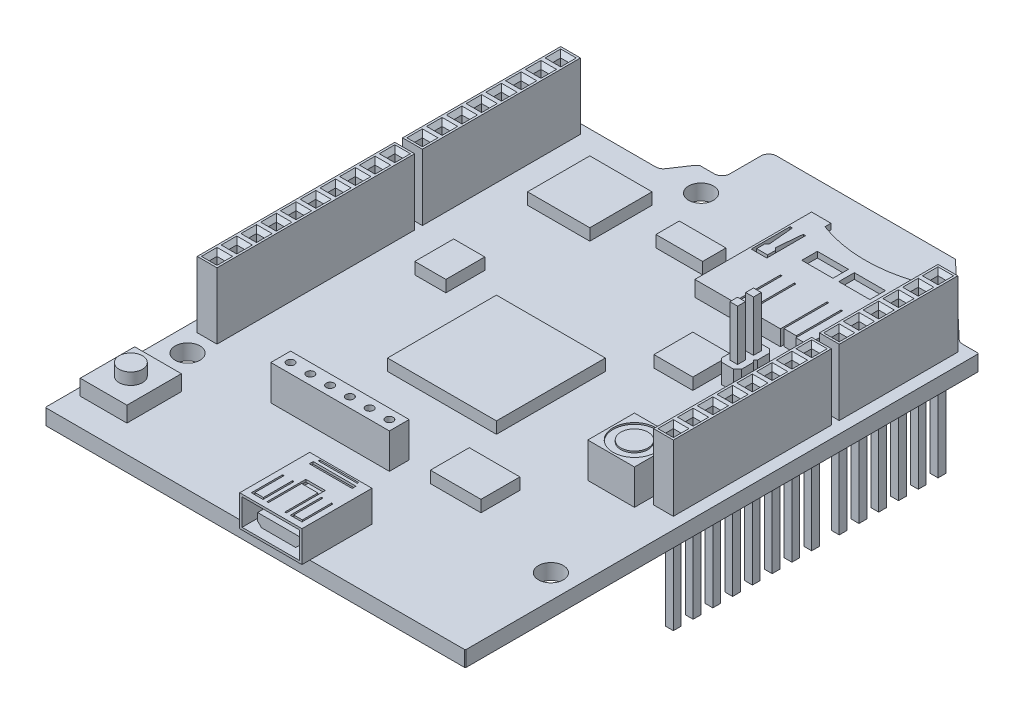
from build123d import *
from OCP.BRepFilletAPI import BRepFilletAPI_MakeChamfer

# Parameters (mm, degrees)
BOSS_EXTRU_1_DEPTH           = 2
ESQUISSE2_W                  = 2.54
ESQUISSE2_H                  = 20.32
ESQUISSE2_W_2                = 1
ESQUISSE2_H_2                = 1
ESQUISSE2_H_3                = 25.4
ESQUISSE2_H_4                = 15.24
BOSS_EXTRU_2_DEPTH           = 8.5
ESQUISSE3_R                  = 1.6
ENL_V_MAT_EXTRU_1_DEPTH      = 93.807596672
ESQUISSE4_W                  = 7.62
ESQUISSE4_H                  = 5.08
ESQUISSE4_W_2                = 1
ESQUISSE4_H_2                = 1
BOSS_EXTRU_3_DEPTH           = 11.5
ESQUISSE5_W                  = 15.24
ESQUISSE5_H                  = 2.54
ESQUISSE5_R                  = 0.5
BOSS_EXTRU_4_DEPTH           = 4.5
ESQUISSE6_W                  = 14
ESQUISSE6_H                  = 14
ESQUISSE6_W_2                = 8
ESQUISSE6_H_2                = 8
ESQUISSE6_W_3                = 6
ESQUISSE6_H_3                = 3
ESQUISSE6_W_4                = 4
ESQUISSE6_H_4                = 5
ESQUISSE6_W_5                = 5
ESQUISSE6_W_6                = 6.5
BOSS_EXTRU_5_DEPTH           = 1.5
ESQUISSE7_W                  = 6
ESQUISSE7_H                  = 7
BOSS_EXTRU_6_DEPTH           = 2
ESQUISSE8_R                  = 1.5
BOSS_EXTRU_7_DEPTH           = 3.5
ESQUISSE9_W                  = 6
ESQUISSE9_H                  = 6
BOSS_EXTRU_8_DEPTH           = 4.5
ESQUISSE10_R                 = 2.75
ESQUISSE10_R_2               = 1.75
ENL_V_MAT_EXTRU_2_DEPTH      = 0.2
ESQUISSE12_W                 = 1
ESQUISSE12_H                 = 1
BOSS_EXTRU_9_DEPTH           = 11.5
BOSS_EXTRU_10_DEPTH          = 2.5
ESQUISSE14_W                 = 1
ESQUISSE14_H                 = 1
BOSS_EXTRU_11_DEPTH          = 9
ESQUISSE15_W                 = 14.5
ESQUISSE15_H                 = 15
BOSS_EXTRU_12_DEPTH          = 2
ESQUISSE16_W                 = 4
ESQUISSE16_H                 = 2
ENL_V_MAT_EXTRU_3_DEPTH      = 94.398340456
ENL_V_MAT_EXTRU_4_DEPTH      = 11.25
ENL_V_MAT_EXTRU_4_DEPTH_BACK = 87.047951748
ESQUISSE17_W                 = 13
ESQUISSE17_H                 = 1.25
ESQUISSE18_W                 = 8
ESQUISSE18_H                 = 9
BOSS_EXTRU_14_DEPTH          = 4
ESQUISSE19_W                 = 5
ESQUISSE19_H                 = 0.2
ESQUISSE19_W_2               = 5.5
ESQUISSE19_H_2               = 0.5
ENL_V_MAT_EXTRU_5_DEPTH      = 0.5
ESQUISSE20_W                 = 7.4
ESQUISSE20_H                 = 3.4
ESQUISSE20_W_2               = 5.4
ESQUISSE20_H_2               = 1.45
ENL_V_MAT_EXTRU_6_DEPTH      = 7.7
ESQUISSE20_2_W               = 7.4
ESQUISSE20_2_H               = 3.4
ENL_V_MAT_EXTRU_7_DEPTH      = 94.130285085
CHANFREIN1_SIZE              = 0.1
CHANFREIN1_SIZE2             = 0.360555128
CHANFREIN2_SIZE              = 0.5
CHANFREIN3_SIZE              = 0.5
CONG_1_R                     = 1


with BuildPart() as part:
    # Esquisse1 → Boss.-Extru.1 (new body)
    with BuildSketch(Plane(origin=(0, 0, 0), x_dir=(1, 0, 0), z_dir=(0, 1, 0))):
        Polygon((0, 0), (54, 0), (54, 66), (51.5, 66), (42, 75), (18, 75), (18, 69), (15, 69), (13, 66), (0, 66), align=None)
    extrude(amount=BOSS_EXTRU_1_DEPTH)

    # Esquisse2 → Boss.-Extru.2 (add)
    # profile 1 of 4: a face of its own
    with BuildSketch(Plane(origin=(0, 2, 0), x_dir=(1, 0, 0), z_dir=(0, 1, 0))):
        with Locations((2.73, 54.64)):
            Rectangle(ESQUISSE2_W, ESQUISSE2_H)
        with Locations((2.73, 60.99)):
            Rectangle(ESQUISSE2_W_2, ESQUISSE2_H_2, mode=Mode.SUBTRACT)
        with Locations((2.73, 63.53)):
            Rectangle(ESQUISSE2_W_2, ESQUISSE2_H_2, mode=Mode.SUBTRACT)
        with Locations((2.73, 58.45)):
            Rectangle(ESQUISSE2_W_2, ESQUISSE2_H_2, mode=Mode.SUBTRACT)
        with Locations((2.73, 55.91)):
            Rectangle(ESQUISSE2_W_2, ESQUISSE2_H_2, mode=Mode.SUBTRACT)
        with Locations((2.73, 53.37)):
            Rectangle(ESQUISSE2_W_2, ESQUISSE2_H_2, mode=Mode.SUBTRACT)
        with Locations((2.73, 50.83)):
            Rectangle(ESQUISSE2_W_2, ESQUISSE2_H_2, mode=Mode.SUBTRACT)
        with Locations((2.73, 48.29)):
            Rectangle(ESQUISSE2_W_2, ESQUISSE2_H_2, mode=Mode.SUBTRACT)
        with Locations((2.73, 45.75)):
            Rectangle(ESQUISSE2_W_2, ESQUISSE2_H_2, mode=Mode.SUBTRACT)
    # profile 2 of 4: a face of its own
    with BuildSketch(Plane(origin=(0, 2, 0), x_dir=(1, 0, 0), z_dir=(0, 1, 0))):
        with Locations((2.73, 30.78)):
            Rectangle(ESQUISSE2_W, ESQUISSE2_H_3)
        with Locations((2.73, 21.89)):
            Rectangle(ESQUISSE2_W_2, ESQUISSE2_H_2, mode=Mode.SUBTRACT)
        with Locations((2.73, 19.35)):
            Rectangle(ESQUISSE2_W_2, ESQUISSE2_H_2, mode=Mode.SUBTRACT)
        with Locations((2.73, 24.43)):
            Rectangle(ESQUISSE2_W_2, ESQUISSE2_H_2, mode=Mode.SUBTRACT)
        with Locations((2.73, 26.97)):
            Rectangle(ESQUISSE2_W_2, ESQUISSE2_H_2, mode=Mode.SUBTRACT)
        with Locations((2.73, 29.51)):
            Rectangle(ESQUISSE2_W_2, ESQUISSE2_H_2, mode=Mode.SUBTRACT)
        with Locations((2.73, 32.05)):
            Rectangle(ESQUISSE2_W_2, ESQUISSE2_H_2, mode=Mode.SUBTRACT)
        with Locations((2.73, 34.59)):
            Rectangle(ESQUISSE2_W_2, ESQUISSE2_H_2, mode=Mode.SUBTRACT)
        with Locations((2.73, 37.13)):
            Rectangle(ESQUISSE2_W_2, ESQUISSE2_H_2, mode=Mode.SUBTRACT)
        with Locations((2.73, 39.67)):
            Rectangle(ESQUISSE2_W_2, ESQUISSE2_H_2, mode=Mode.SUBTRACT)
        with Locations((2.73, 42.21)):
            Rectangle(ESQUISSE2_W_2, ESQUISSE2_H_2, mode=Mode.SUBTRACT)
    # profile 3 of 4: a face of its own
    with BuildSketch(Plane(origin=(0, 2, 0), x_dir=(1, 0, 0), z_dir=(0, 1, 0))):
        with Locations((51.23, 57.18)):
            Rectangle(ESQUISSE2_W, ESQUISSE2_H_4)
        with Locations((51.23, 60.99)):
            Rectangle(ESQUISSE2_W_2, ESQUISSE2_H_2, mode=Mode.SUBTRACT)
        with Locations((51.23, 63.53)):
            Rectangle(ESQUISSE2_W_2, ESQUISSE2_H_2, mode=Mode.SUBTRACT)
        with Locations((51.23, 58.45)):
            Rectangle(ESQUISSE2_W_2, ESQUISSE2_H_2, mode=Mode.SUBTRACT)
        with Locations((51.23, 55.91)):
            Rectangle(ESQUISSE2_W_2, ESQUISSE2_H_2, mode=Mode.SUBTRACT)
        with Locations((51.23, 53.37)):
            Rectangle(ESQUISSE2_W_2, ESQUISSE2_H_2, mode=Mode.SUBTRACT)
        with Locations((51.23, 50.83)):
            Rectangle(ESQUISSE2_W_2, ESQUISSE2_H_2, mode=Mode.SUBTRACT)
    # profile 4 of 4: a face of its own
    with BuildSketch(Plane(origin=(0, 2, 0), x_dir=(1, 0, 0), z_dir=(0, 1, 0))):
        with Locations((51.23, 38.4)):
            Rectangle(ESQUISSE2_W, ESQUISSE2_H)
        with Locations((51.23, 47.29)):
            Rectangle(ESQUISSE2_W_2, ESQUISSE2_H_2, mode=Mode.SUBTRACT)
        with Locations((51.23, 44.75)):
            Rectangle(ESQUISSE2_W_2, ESQUISSE2_H_2, mode=Mode.SUBTRACT)
        with Locations((51.23, 42.21)):
            Rectangle(ESQUISSE2_W_2, ESQUISSE2_H_2, mode=Mode.SUBTRACT)
        with Locations((51.23, 39.67)):
            Rectangle(ESQUISSE2_W_2, ESQUISSE2_H_2, mode=Mode.SUBTRACT)
        with Locations((51.23, 37.13)):
            Rectangle(ESQUISSE2_W_2, ESQUISSE2_H_2, mode=Mode.SUBTRACT)
        with Locations((51.23, 34.59)):
            Rectangle(ESQUISSE2_W_2, ESQUISSE2_H_2, mode=Mode.SUBTRACT)
        with Locations((51.23, 32.05)):
            Rectangle(ESQUISSE2_W_2, ESQUISSE2_H_2, mode=Mode.SUBTRACT)
        with Locations((51.23, 29.51)):
            Rectangle(ESQUISSE2_W_2, ESQUISSE2_H_2, mode=Mode.SUBTRACT)
    extrude(amount=BOSS_EXTRU_2_DEPTH)

    # Esquisse3 → Enlèv. mat.-Extru.1 (cut, through all)
    with BuildSketch(Plane(origin=(0, 2, 0), x_dir=(1, 0, 0), z_dir=(0, 1, 0))):
        with Locations(Location((18.3, 66, 0), (0, 0, 270))):
            Circle(ESQUISSE3_R)
        with Locations(Location((46.2, 66, 0), (0, 0, 270))):
            Circle(ESQUISSE3_R)
        with Locations(Location((50.9, 14.1, 0), (0, 0, 270))):
            Circle(ESQUISSE3_R)
        with Locations(Location((3.1, 15.2, 0), (0, 0, 270))):
            Circle(ESQUISSE3_R)
    extrude(amount=-ENL_V_MAT_EXTRU_1_DEPTH, mode=Mode.SUBTRACT)

    # Esquisse4 → Boss.-Extru.3 (add)
    with BuildSketch(Plane(origin=(0, 0, 0), x_dir=(1, 0, 0), z_dir=(0, 1, 0))):
        with Locations((26.41, 64.6)):
            Rectangle(ESQUISSE4_W, ESQUISSE4_H)
        with Locations((26.41, 63.33)):
            Rectangle(ESQUISSE4_W_2, ESQUISSE4_H_2, mode=Mode.SUBTRACT)
        with Locations((23.87, 63.33)):
            Rectangle(ESQUISSE4_W_2, ESQUISSE4_H_2, mode=Mode.SUBTRACT)
        with Locations((28.95, 63.33)):
            Rectangle(ESQUISSE4_W_2, ESQUISSE4_H_2, mode=Mode.SUBTRACT)
        with Locations((26.41, 65.87)):
            Rectangle(ESQUISSE4_W_2, ESQUISSE4_H_2, mode=Mode.SUBTRACT)
        with Locations((28.95, 65.87)):
            Rectangle(ESQUISSE4_W_2, ESQUISSE4_H_2, mode=Mode.SUBTRACT)
        with Locations((23.87, 65.87)):
            Rectangle(ESQUISSE4_W_2, ESQUISSE4_H_2, mode=Mode.SUBTRACT)
    extrude(amount=-BOSS_EXTRU_3_DEPTH)

    # Esquisse5 → Boss.-Extru.4 (add)
    with BuildSketch(Plane(origin=(0, 2, 0), x_dir=(1, 0, 0), z_dir=(0, 1, 0))):
        with Locations((21.62, 16.27)):
            Rectangle(ESQUISSE5_W, ESQUISSE5_H)
        with Locations(Location((15.27, 16.27, 0), (0, 0, 270))):
            Circle(ESQUISSE5_R, mode=Mode.SUBTRACT)
        with Locations(Location((17.81, 16.27, 0), (0, 0, 270))):
            Circle(ESQUISSE5_R, mode=Mode.SUBTRACT)
        with Locations(Location((20.35, 16.27, 0), (0, 0, 270))):
            Circle(ESQUISSE5_R, mode=Mode.SUBTRACT)
        with Locations(Location((22.89, 16.27, 0), (0, 0, 270))):
            Circle(ESQUISSE5_R, mode=Mode.SUBTRACT)
        with Locations(Location((25.43, 16.27, 0), (0, 0, 270))):
            Circle(ESQUISSE5_R, mode=Mode.SUBTRACT)
        with Locations(Location((27.97, 16.27, 0), (0, 0, 270))):
            Circle(ESQUISSE5_R, mode=Mode.SUBTRACT)
    extrude(amount=BOSS_EXTRU_4_DEPTH)

    # Esquisse6 → Boss.-Extru.5 (add)
    with BuildSketch(Plane(origin=(0, 2, 0), x_dir=(1, 0, 0), z_dir=(0, 1, 0))):
        with Locations((25, 33)):
            Rectangle(ESQUISSE6_W, ESQUISSE6_H)
        with Locations((12.5, 57.5)):
            Rectangle(ESQUISSE6_W_2, ESQUISSE6_H_2)
        with Locations((24.5, 58.5)):
            Rectangle(ESQUISSE6_W_3, ESQUISSE6_H_3)
        with Locations((11, 41)):
            Rectangle(ESQUISSE6_W_4, ESQUISSE6_H_4)
        with Locations((37.24, 46)):
            Rectangle(ESQUISSE6_W_5, ESQUISSE6_H_4)
        with Locations((36.49, 18.77)):
            Rectangle(ESQUISSE6_W_6, ESQUISSE6_H_4)
    extrude(amount=BOSS_EXTRU_5_DEPTH)

    # Esquisse7 → Boss.-Extru.6 (add)
    with BuildSketch(Plane(origin=(0, 2, 0), x_dir=(1, 0, 0), z_dir=(0, 1, 0))):
        with Locations((4, 7)):
            Rectangle(ESQUISSE7_W, ESQUISSE7_H)
    extrude(amount=BOSS_EXTRU_6_DEPTH)

    # Esquisse8 → Boss.-Extru.7 (add)
    with BuildSketch(Plane(origin=(0, 2, 0), x_dir=(1, 0, 0), z_dir=(0, 1, 0))):
        with Locations(Location((4, 7, 0), (0, 0, 270))):
            Circle(ESQUISSE8_R)
    extrude(amount=BOSS_EXTRU_7_DEPTH)

    # Esquisse9 → Boss.-Extru.8 (add)
    with BuildSketch(Plane(origin=(0, 2, 0), x_dir=(1, 0, 0), z_dir=(0, 1, 0))):
        with Locations((46, 29.74)):
            Rectangle(ESQUISSE9_W, ESQUISSE9_H)
    extrude(amount=BOSS_EXTRU_8_DEPTH)

    # Esquisse10 → Enlèv. mat.-Extru.2 (cut)
    with BuildSketch(Plane(origin=(0, 6.5, 0), x_dir=(1, 0, 0), z_dir=(0, 1, 0))):
        with Locations(Location((46, 29.74, 0), (0, 0, 270))):
            Circle(ESQUISSE10_R)
        with Locations(Location((46, 29.74, 0), (0, 0, 270))):
            Circle(ESQUISSE10_R_2, mode=Mode.SUBTRACT)
    extrude(amount=-ENL_V_MAT_EXTRU_2_DEPTH, mode=Mode.SUBTRACT)

    # Esquisse12 → Boss.-Extru.9 (add)
    with BuildSketch(Plane(origin=(0, 0, 0), x_dir=(1, 0, 0), z_dir=(0, 1, 0))):
        with Locations((2.73, 63.53)):
            Rectangle(ESQUISSE12_W, ESQUISSE12_H)
        with Locations((2.73, 60.99)):
            Rectangle(ESQUISSE12_W, ESQUISSE12_H)
        with Locations((2.73, 58.45)):
            Rectangle(ESQUISSE12_W, ESQUISSE12_H)
        with Locations((2.73, 55.91)):
            Rectangle(ESQUISSE12_W, ESQUISSE12_H)
        with Locations((2.73, 53.37)):
            Rectangle(ESQUISSE12_W, ESQUISSE12_H)
        with Locations((2.73, 50.83)):
            Rectangle(ESQUISSE12_W, ESQUISSE12_H)
        with Locations((2.73, 48.29)):
            Rectangle(ESQUISSE12_W, ESQUISSE12_H)
        with Locations((2.73, 45.75)):
            Rectangle(ESQUISSE12_W, ESQUISSE12_H)
        with Locations((2.73, 42.21)):
            Rectangle(ESQUISSE12_W, ESQUISSE12_H)
        with Locations((2.73, 39.67)):
            Rectangle(ESQUISSE12_W, ESQUISSE12_H)
        with Locations((2.73, 37.13)):
            Rectangle(ESQUISSE12_W, ESQUISSE12_H)
        with Locations((2.73, 34.59)):
            Rectangle(ESQUISSE12_W, ESQUISSE12_H)
        with Locations((2.73, 32.05)):
            Rectangle(ESQUISSE12_W, ESQUISSE12_H)
        with Locations((2.73, 29.51)):
            Rectangle(ESQUISSE12_W, ESQUISSE12_H)
        with Locations((2.73, 26.97)):
            Rectangle(ESQUISSE12_W, ESQUISSE12_H)
        with Locations((2.73, 24.43)):
            Rectangle(ESQUISSE12_W, ESQUISSE12_H)
        with Locations((2.73, 21.89)):
            Rectangle(ESQUISSE12_W, ESQUISSE12_H)
        with Locations((2.73, 19.35)):
            Rectangle(ESQUISSE12_W, ESQUISSE12_H)
        with Locations((51.23, 29.51)):
            Rectangle(ESQUISSE12_W, ESQUISSE12_H)
        with Locations((51.23, 32.05)):
            Rectangle(ESQUISSE12_W, ESQUISSE12_H)
        with Locations((51.23, 34.59)):
            Rectangle(ESQUISSE12_W, ESQUISSE12_H)
        with Locations((51.23, 37.13)):
            Rectangle(ESQUISSE12_W, ESQUISSE12_H)
        with Locations((51.23, 39.67)):
            Rectangle(ESQUISSE12_W, ESQUISSE12_H)
        with Locations((51.23, 42.21)):
            Rectangle(ESQUISSE12_W, ESQUISSE12_H)
        with Locations((51.23, 44.75)):
            Rectangle(ESQUISSE12_W, ESQUISSE12_H)
        with Locations((51.23, 47.29)):
            Rectangle(ESQUISSE12_W, ESQUISSE12_H)
        with Locations((51.23, 50.83)):
            Rectangle(ESQUISSE12_W, ESQUISSE12_H)
        with Locations((51.23, 53.37)):
            Rectangle(ESQUISSE12_W, ESQUISSE12_H)
        with Locations((51.23, 55.91)):
            Rectangle(ESQUISSE12_W, ESQUISSE12_H)
        with Locations((51.23, 58.45)):
            Rectangle(ESQUISSE12_W, ESQUISSE12_H)
        with Locations((51.23, 60.99)):
            Rectangle(ESQUISSE12_W, ESQUISSE12_H)
        with Locations((51.23, 63.53)):
            Rectangle(ESQUISSE12_W, ESQUISSE12_H)
    extrude(amount=-BOSS_EXTRU_9_DEPTH)

    # Esquisse13 → Boss.-Extru.10 (add)
    with BuildSketch(Plane(origin=(0, 2, 0), x_dir=(1, 0, 0), z_dir=(0, 1, 0))):
        Polygon((40.96, 50.58), (40.46, 50.08), (40.46, 48.54), (40.71, 48.29), (40.46, 48.04), (40.46, 46.5), (40.96, 46), (42.5, 46), (43, 46.5), (43, 48.04), (42.75, 48.29), (43, 48.54), (43, 50.08), (42.5, 50.58), align=None)
    extrude(amount=BOSS_EXTRU_10_DEPTH)

    # Esquisse14 → Boss.-Extru.11 (add)
    with BuildSketch(Plane(origin=(0, 2, 0), x_dir=(1, 0, 0), z_dir=(0, 1, 0))):
        with Locations((41.73, 49.31)):
            Rectangle(ESQUISSE14_W, ESQUISSE14_H)
        with Locations((41.73, 47.27)):
            Rectangle(ESQUISSE14_W, ESQUISSE14_H)
    extrude(amount=BOSS_EXTRU_11_DEPTH)

    # Esquisse15 → Boss.-Extru.12 (add)
    with BuildSketch(Plane(origin=(0, 2, 0), x_dir=(1, 0, 0), z_dir=(0, 1, 0))):
        with Locations((36.75, 61.5)):
            Rectangle(ESQUISSE15_W, ESQUISSE15_H)
    extrude(amount=BOSS_EXTRU_12_DEPTH)

    # Esquisse16 → Enlèv. mat.-Extru.3 (cut, through all)
    with BuildSketch(Plane(origin=(0, 2, 0), x_dir=(1, 0, 0), z_dir=(0, 1, 0))):
        Polygon((30.05, 66), (30.35, 62.7), (30.05, 62.4), (30.05, 61.4), (31.45, 61.4), (31.45, 62.4), (31.15, 62.7), (31.45, 66), (31.75, 66), (31.75, 61), (29.75, 61), (29.75, 66), align=None)
        with BuildLine():
            Line((32, 68.225), (32, 69))
            Line((32, 69), (44, 69))
            Line((44, 69), (44, 68))
            ThreePointArc((44, 68), (37.98060858, 67.078290923), (32, 68.225))
        make_face()
        with Locations((36.25, 64)):
            Rectangle(ESQUISSE16_W, ESQUISSE16_H)
        with Locations((41, 64)):
            Rectangle(ESQUISSE16_W, ESQUISSE16_H)
        Polygon((34.5, 60), (34.7, 60), (34.7, 54.25), (36.3, 54.25), (36.3, 60), (36.5, 60), (36.5, 54), (34.5, 54), align=None)
        Polygon((40.5, 60), (40.7, 60), (40.7, 54.25), (42.3, 54.25), (42.3, 60), (42.5, 60), (42.5, 54), (40.5, 54), align=None)
    extrude(amount=ENL_V_MAT_EXTRU_3_DEPTH, mode=Mode.SUBTRACT)

    # Esquisse17 → Enlèv. mat.-Extru.4 (cut, two sides: drawn at the far end of the back side and taken through both)
    with BuildSketch(Plane.XY.offset(-66).offset(-ENL_V_MAT_EXTRU_4_DEPTH_BACK)):
        with Locations((36.75, 2.625)):
            Rectangle(ESQUISSE17_W, ESQUISSE17_H)
    extrude(amount=ENL_V_MAT_EXTRU_4_DEPTH + ENL_V_MAT_EXTRU_4_DEPTH_BACK, mode=Mode.SUBTRACT)

    # Esquisse18 → Boss.-Extru.14 (add)
    with BuildSketch(Plane(origin=(0, 2, 0), x_dir=(1, 0, 0), z_dir=(0, 1, 0))):
        with Locations((30, 3.5)):
            Rectangle(ESQUISSE18_W, ESQUISSE18_H)
    extrude(amount=BOSS_EXTRU_14_DEPTH)

    # Esquisse19 → Enlèv. mat.-Extru.5 (cut)
    with BuildSketch(Plane(origin=(0, 6, 0), x_dir=(1, 0, 0), z_dir=(0, 1, 0))):
        with Locations((30, 7.7)):
            Rectangle(ESQUISSE19_W, ESQUISSE19_H)
        with Locations((30, 6.95)):
            Rectangle(ESQUISSE19_W_2, ESQUISSE19_H_2)
        Polygon((31.75, 3.75), (31.95, 3.75), (31.95, 0), (33.05, 0), (33.05, 3.75), (33.25, 3.75), (33.25, -0.25), (31.75, -0.25), align=None)
        Polygon((26.75, 3.75), (26.95, 3.75), (26.95, 0), (28.05, 0), (28.05, 3.75), (28.25, 3.75), (28.25, -0.25), (26.75, -0.25), align=None)
        Polygon((31.05, -0.25), (31.25, -0.25), (31.25, 4.75), (28.75, 4.75), (28.75, -0.25), (28.95, -0.25), (28.95, 4), (31.05, 4), align=None)
    extrude(amount=-ENL_V_MAT_EXTRU_5_DEPTH, mode=Mode.SUBTRACT)

    # Esquisse20 → Enlèv. mat.-Extru.6 (cut)
    with BuildSketch(Plane.XY):
        with Locations((30, 4)):
            Rectangle(ESQUISSE20_W, ESQUISSE20_H)
        with Locations((30, 3.225)):
            Rectangle(ESQUISSE20_W_2, ESQUISSE20_H_2, mode=Mode.SUBTRACT)
    extrude(amount=-ENL_V_MAT_EXTRU_6_DEPTH, mode=Mode.SUBTRACT)

    # Esquisse20<2> → Enlèv. mat.-Extru.7 (cut, through all)
    with BuildSketch(Plane.XY):
        with Locations((30, 4)):
            Rectangle(ESQUISSE20_2_W, ESQUISSE20_2_H)
    extrude(amount=ENL_V_MAT_EXTRU_7_DEPTH, mode=Mode.SUBTRACT)

    # Chanfrein1: one chamfer whose edges measure the first distance from different faces: ONE call of the kernel's chamfer builder (chamfer() names one face for all edges)
    chanfrein1_edges_1 = [part.edges().sort_by_distance(p)[0] for p in [
        (54, 1, 0),
        (54, 1, -66),
        (0, 1, -66),
        (0, 1, 0),
    ]]
    chanfrein1_edges_2 = [part.edges().sort_by_distance(p)[0] for p in [
        (15, 1, -69),
    ]]
    chanfrein1_side_2 = [part.faces().sort_by_distance(p)[0] for p in [
        (16.5, 1, -69),
    ]]
    chanfrein1 = BRepFilletAPI_MakeChamfer(part.part.solid().wrapped)
    for e in chanfrein1_edges_1:
        chanfrein1.Add(CHANFREIN1_SIZE, e.wrapped)
    for e in chanfrein1_edges_2:
        chanfrein1.Add(CHANFREIN1_SIZE, CHANFREIN1_SIZE2, e.wrapped, chanfrein1_side_2[0].wrapped)  # the first distance lies on this face
    add(Compound.cast(chanfrein1.Shape()), mode=Mode.REPLACE)

    # Chanfrein2
    chanfrein2_edges = [part.edges().sort_by_distance(p)[0] for p in [
        (3.23, 10.5, -19.35),
        (2.73, 10.5, -19.85),
        (2.23, 10.5, -19.35),
        (2.73, 10.5, -18.85),
        (3.23, 10.5, -21.89),
        (2.73, 10.5, -22.39),
        (2.23, 10.5, -21.89),
        (2.73, 10.5, -21.39),
        (3.23, 10.5, -24.43),
        (2.73, 10.5, -24.93),
        (2.23, 10.5, -24.43),
        (2.73, 10.5, -23.93),
        (3.23, 10.5, -26.97),
        (2.73, 10.5, -27.47),
        (2.23, 10.5, -26.97),
        (2.73, 10.5, -26.47),
        (3.23, 10.5, -29.51),
        (2.73, 10.5, -30.01),
        (2.23, 10.5, -29.51),
        (2.73, 10.5, -29.01),
        (3.23, 10.5, -32.05),
        (2.73, 10.5, -32.55),
        (2.23, 10.5, -32.05),
        (2.73, 10.5, -31.55),
        (3.23, 10.5, -34.59),
        (2.73, 10.5, -35.09),
        (2.23, 10.5, -34.59),
        (2.73, 10.5, -34.09),
        (3.23, 10.5, -37.13),
        (2.73, 10.5, -37.63),
        (2.23, 10.5, -37.13),
        (2.73, 10.5, -36.63),
        (3.23, 10.5, -39.67),
        (2.73, 10.5, -40.17),
        (2.23, 10.5, -39.67),
        (2.73, 10.5, -39.17),
        (3.23, 10.5, -42.21),
        (2.73, 10.5, -42.71),
        (2.23, 10.5, -42.21),
        (2.73, 10.5, -41.71),
        (51.73, 10.5, -63.53),
        (51.23, 10.5, -64.03),
        (50.73, 10.5, -63.53),
        (51.23, 10.5, -63.03),
        (51.73, 10.5, -60.99),
        (51.23, 10.5, -61.49),
        (50.73, 10.5, -60.99),
        (51.23, 10.5, -60.49),
        (51.73, 10.5, -58.45),
        (51.23, 10.5, -58.95),
        (50.73, 10.5, -58.45),
        (51.23, 10.5, -57.95),
        (51.73, 10.5, -55.91),
        (51.23, 10.5, -56.41),
        (50.73, 10.5, -55.91),
        (51.23, 10.5, -55.41),
        (51.73, 10.5, -53.37),
        (51.23, 10.5, -53.87),
        (50.73, 10.5, -53.37),
        (51.23, 10.5, -52.87),
        (51.73, 10.5, -50.83),
        (51.23, 10.5, -51.33),
        (50.73, 10.5, -50.83),
        (51.23, 10.5, -50.33),
        (51.73, 10.5, -47.29),
        (51.23, 10.5, -47.79),
        (50.73, 10.5, -47.29),
        (51.23, 10.5, -46.79),
        (51.73, 10.5, -44.75),
        (51.23, 10.5, -45.25),
        (50.73, 10.5, -44.75),
        (51.23, 10.5, -44.25),
        (51.73, 10.5, -42.21),
        (51.23, 10.5, -42.71),
        (50.73, 10.5, -42.21),
        (51.23, 10.5, -41.71),
        (51.73, 10.5, -39.67),
        (51.23, 10.5, -40.17),
        (50.73, 10.5, -39.67),
        (51.23, 10.5, -39.17),
        (51.73, 10.5, -37.13),
        (51.23, 10.5, -37.63),
        (50.73, 10.5, -37.13),
        (51.23, 10.5, -36.63),
        (51.73, 10.5, -34.59),
        (51.23, 10.5, -35.09),
        (50.73, 10.5, -34.59),
        (51.23, 10.5, -34.09),
        (51.73, 10.5, -32.05),
        (51.23, 10.5, -32.55),
        (50.73, 10.5, -32.05),
        (51.23, 10.5, -31.55),
        (51.73, 10.5, -29.51),
        (51.23, 10.5, -30.01),
        (50.73, 10.5, -29.51),
        (51.23, 10.5, -29.01),
        (23.87, -11.5, -63.83),
        (23.37, -11.5, -63.33),
        (23.87, -11.5, -62.83),
        (24.37, -11.5, -63.33),
        (26.41, -11.5, -63.83),
        (25.91, -11.5, -63.33),
        (26.41, -11.5, -62.83),
        (26.91, -11.5, -63.33),
        (28.95, -11.5, -63.83),
        (28.45, -11.5, -63.33),
        (28.95, -11.5, -62.83),
        (29.45, -11.5, -63.33),
        (26.41, -11.5, -66.37),
        (25.91, -11.5, -65.87),
        (26.41, -11.5, -65.37),
        (26.91, -11.5, -65.87),
        (28.95, -11.5, -66.37),
        (28.45, -11.5, -65.87),
        (28.95, -11.5, -65.37),
        (29.45, -11.5, -65.87),
        (23.87, -11.5, -66.37),
        (23.37, -11.5, -65.87),
        (23.87, -11.5, -65.37),
        (24.37, -11.5, -65.87),
        (3.23, 10.5, -63.53),
        (2.73, 10.5, -64.03),
        (2.23, 10.5, -63.53),
        (2.73, 10.5, -63.03),
        (3.23, 10.5, -60.99),
        (2.73, 10.5, -61.49),
        (2.23, 10.5, -60.99),
        (2.73, 10.5, -60.49),
        (3.23, 10.5, -58.45),
        (2.73, 10.5, -58.95),
        (2.23, 10.5, -58.45),
        (2.73, 10.5, -57.95),
        (3.23, 10.5, -55.91),
        (2.73, 10.5, -56.41),
        (2.23, 10.5, -55.91),
        (2.73, 10.5, -55.41),
        (3.23, 10.5, -53.37),
        (2.73, 10.5, -53.87),
        (2.23, 10.5, -53.37),
        (2.73, 10.5, -52.87),
        (3.23, 10.5, -50.83),
        (2.73, 10.5, -51.33),
        (2.23, 10.5, -50.83),
        (2.73, 10.5, -50.33),
        (3.23, 10.5, -48.29),
        (2.73, 10.5, -48.79),
        (2.23, 10.5, -48.29),
        (2.73, 10.5, -47.79),
        (3.23, 10.5, -45.75),
        (2.73, 10.5, -46.25),
        (2.23, 10.5, -45.75),
        (2.73, 10.5, -45.25),
    ]]
    chamfer(chanfrein2_edges, length=CHANFREIN2_SIZE)

    # Chanfrein3
    chanfrein3_edges = [part.edges().sort_by_distance(p)[0] for p in [
        (27.3, 2.5, -3.85),
        (32.7, 2.5, -3.85),
    ]]
    chamfer(chanfrein3_edges, length=CHANFREIN3_SIZE)

    # Congé1
    cong_1_edges = [part.edges().sort_by_distance(p)[0] for p in [
        (51.5, 1, -66),
        (18, 1, -75),
        (18, 1, -69),
        (13, 1, -66),
    ]]
    fillet(cong_1_edges, radius=CONG_1_R)


solid = part.part
